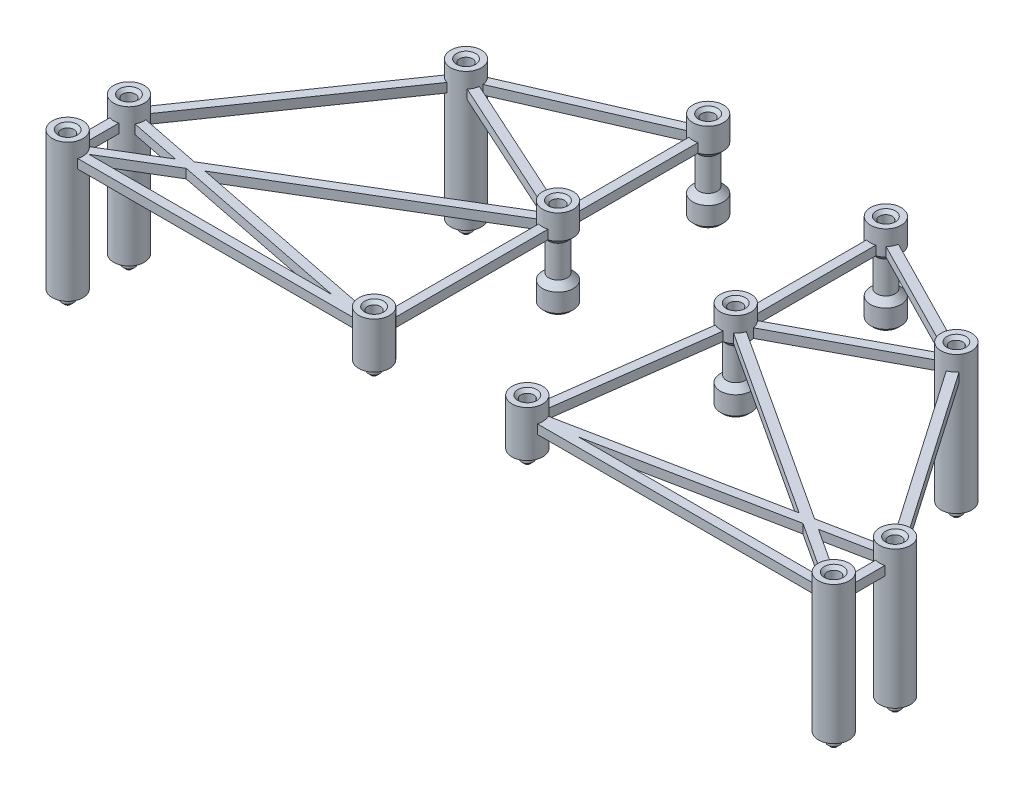
from build123d import *

# Parameters (mm, degrees)
SKETCH_2_R              = 5.000000000000076
EXTRUDE_1_DEPTH         = 40
SKETCH_2_R_2            = 5.000000000000065
EXTRUDE_1_2_DEPTH       = 40
SKETCH_2_R_3            = 5.000000000000094
EXTRUDE_1_3_DEPTH       = 40
SKETCH_2_R_4            = 5.000000000000083
EXTRUDE_1_4_DEPTH       = 40
SKETCH_2_R_5            = 5.000000000000005
EXTRUDE_1_5_DEPTH       = 40
SKETCH_2_R_6            = 5.000000000000019
EXTRUDE_1_6_DEPTH       = 40
SKETCH_2_R_7            = 4.9999999999999885
EXTRUDE_1_7_DEPTH       = 40
SKETCH_2_R_8            = 5
EXTRUDE_1_8_DEPTH       = 40
EXTRUDE_START           = -3
EXTRUDE_2_DEPTH         = 3
EXTRUDE_START_2         = -24.4
EXTRUDE_3_OUTLINE_R     = 3
EXTRUDE_3_DEPTH         = 24.4
EXTRUDE_3_2_OUTLINE_W   = 3
EXTRUDE_3_2_OUTLINE_H   = 24.400000000000002
SKETCH_5_R              = 3.0000000000017404
SKETCH_5_R_2            = 2.999999999999992
EXTRUDE_4_DEPTH         = 24.4
EXTRUDE_5_DEPTH         = 5
EXTRUDE_5_DEPTH_BACK    = 3
SKETCH_6_R              = 5.000000000000004
SKETCH_6_R_2            = 4.999999999999988
SKETCH_6_R_3            = 5.00000000000002
SKETCH_6_R_4            = 4.999999999999998
SKETCH_6_R_5            = 4.999999999999999
SKETCH_6_R_6            = 5.000000000000106
SKETCH_6_R_7            = 5.000000000000005
SKETCH_6_R_8            = 5.000000000000002
CHAMFER_1_SIZE          = 2
CHAMFER_2_SIZE          = 2
SKETCH_7_R              = 2.100000000000004
SKETCH_7_R_2            = 2.100000000000005
SKETCH_7_R_3            = 2.09999999999999
SKETCH_7_R_4            = 2.1000000000000183
SKETCH_7_R_5            = 2.1000000000001062
SKETCH_7_R_6            = 2.100000000000001
CUT_EXTRUDE_1_DEPTH     = 5
CUT_EXTRUDE_START       = -30
CUT_EXTRUDE_2_OUTLINE_R = 5
CUT_EXTRUDE_2_DEPTH     = 30
SKETCH_11_R             = 1.9000000000000012
SKETCH_11_R_2           = 1.9000000000000035
SKETCH_11_R_3           = 1.8999999999999737
SKETCH_11_R_4           = 1.9000000000000892
SKETCH_11_R_5           = 1.9000000000000732
EXTRUDE_6_DEPTH         = 4
SKETCH_12_R             = 1.9000000000000057
SKETCH_12_R_2           = 1.900000000000078
EXTRUDE_7_DEPTH         = 4
SKETCH_14_R             = 4.999999999999998
SKETCH_14_R_2           = 5.000000000000002
EXTRUDE_9_DEPTH         = 7
CHAMFER_3_SIZE          = 2
CHAMFER_4_SIZE          = 2
CUT_EXTRUDE_START_2     = -5
SKETCH_15_R             = 2.0999999999999988
SKETCH_15_R_2           = 2.100000000000002
CUT_EXTRUDE_3_DEPTH     = 5
CHAMFER_6_SIZE          = 1
CHAMFER_7_SIZE          = 1
EXTRUDE_10_DEPTH        = 5
EXTRUDE_10_DEPTH_BACK   = 3
SKETCH_17_R             = 4.999999999999998
SKETCH_17_R_2           = 5.000000000000002
CHAMFER_8_SIZE          = 2
CHAMFER_9_SIZE          = 2
SKETCH_18_R             = 2.100000000000005
CUT_EXTRUDE_4_DEPTH     = 5
CHAMFER_10_SIZE         = 1
CHAMFER_11_SIZE         = 1


# Read off the part's stored shape, not the designer's step: 보스-돌출3, 컷-돌출2
with BuildPart() as part:
    # 스케치2 → 보스-돌출1 (new body)
    with BuildSketch(Plane(origin=(0, 0, 0), x_dir=(1, 0, 0), z_dir=(0, 1, 0))):
        with Locations(Location((-25.0000000000001, 14.999999999999812, 0), (0, 0, 270))):
            Circle(SKETCH_2_R)
    extrude(amount=EXTRUDE_1_DEPTH)



with BuildPart() as body_2:
    # 스케치2 → Extrude 1 2 (new body)
    with BuildSketch(Plane(origin=(0, 0, 0), x_dir=(1, 0, 0), z_dir=(0, 1, 0))):
        with Locations(Location((-125.00000000000014, 14.999999999999108, 0), (0, 0, 270))):
            Circle(SKETCH_2_R_2)
    extrude(amount=EXTRUDE_1_2_DEPTH)


with BuildPart() as body_3:
    # 스케치2 → Extrude 1 3 (new body)
    with BuildSketch(Plane(origin=(0, 0, 0), x_dir=(1, 0, 0), z_dir=(0, 1, 0))):
        with Locations(Location((-125.00000000000028, 34.999999999999105, 0), (0, 0, 270))):
            Circle(SKETCH_2_R_3)
    extrude(amount=EXTRUDE_1_3_DEPTH)


with BuildPart() as body_4:
    # 스케치2 → Extrude 1 4 (new body)
    with BuildSketch(Plane(origin=(0, 0, 0), x_dir=(1, 0, 0), z_dir=(0, 1, 0))):
        with Locations(Location((-80.0000000000007, 99.99999999999945, 0), (0, 0, 270))):
            Circle(SKETCH_2_R_4)
    extrude(amount=EXTRUDE_1_4_DEPTH)


with BuildPart() as body_5:
    # 스케치2 → Extrude 1 5 (new body)
    with BuildSketch(Plane(origin=(0, 0, 0), x_dir=(1, 0, 0), z_dir=(0, 1, 0))):
        with Locations(Location((80.00000000000064, 99.99999999999953, 0), (0, 0, 90))):
            Circle(SKETCH_2_R_5)
    extrude(amount=EXTRUDE_1_5_DEPTH)


with BuildPart() as body_6:
    # 스케치2 → Extrude 1 6 (new body)
    with BuildSketch(Plane(origin=(0, 0, 0), x_dir=(1, 0, 0), z_dir=(0, 1, 0))):
        with Locations(Location((125.00000000000023, 34.99999999999918, 0), (0, 0, 90))):
            Circle(SKETCH_2_R_6)
    extrude(amount=EXTRUDE_1_6_DEPTH)


with BuildPart() as body_7:
    # 스케치2 → Extrude 1 7 (new body)
    with BuildSketch(Plane(origin=(0, 0, 0), x_dir=(1, 0, 0), z_dir=(0, 1, 0))):
        with Locations(Location((125.00000000000009, 14.999999999999186, 0), (0, 0, 90))):
            Circle(SKETCH_2_R_7)
    extrude(amount=EXTRUDE_1_7_DEPTH)


with BuildPart() as body_8:
    # 스케치2 → Extrude 1 8 (new body)
    with BuildSketch(Plane(origin=(0, 0, 0), x_dir=(1, 0, 0), z_dir=(0, 1, 0))):
        with Locations(Location((25.000000000000043, 14.99999999999989, 0), (0, 0, 90))):
            Circle(SKETCH_2_R_8)
    extrude(amount=EXTRUDE_1_8_DEPTH)


with BuildPart() as part_1:
    add(part.part)

    add(body_2.part)  # 보스-돌출2 merges body 2

    add(body_3.part)  # 보스-돌출2 merges body 3

    add(body_4.part)  # 보스-돌출2 merges body 4

    add(body_5.part)  # 보스-돌출2 merges body 5

    add(body_6.part)  # 보스-돌출2 merges body 6

    add(body_7.part)  # 보스-돌출2 merges body 7

    add(body_8.part)  # 보스-돌출2 merges body 8
    # 스케치3 → 보스-돌출2 (add)
    # profile 1 of 6: a face of its own
    with BuildSketch(Plane(origin=(0, 40, 0), x_dir=(1, 0, 0), z_dir=(0, 1, 0)).offset(EXTRUDE_START)):
        with BuildLine():
            ThreePointArc((120.61710246924122, 32.5937146397672), (120.09709662154395, 34.0194193243165), (120.02875406382756, 35.53545666686118))
            Line((120.02875406382756, 35.53545666686121), (101.8370079596634, 31.897107446024865))
            Line((101.8370079596634, 31.89710744602486), (35.9472519757672, 74.8686874355099))
            Line((35.9472519757672, 74.8686874355099), (76.49338655013159, 96.43578029392111))
            ThreePointArc((76.49338655013156, 96.43578029392117), (75.58563805406766, 97.6519351349886), (75.08454763100396, 99.08439746170853))
            Line((75.08454763100391, 99.08439746170858), (34.49999999999911, 77.49687212606887))
            Line((34.49999999999911, 77.49687212606887), (34.49999999999911, 121.54979470613318))
            Line((34.49999999999911, 121.54979470613318), (75.06991788925826, 100.83324089034133))
            ThreePointArc((75.0699178892582, 100.83324089034127), (75.54697367546154, 102.2738857827428), (76.43424935890415, 103.5050566850647))
            Line((76.43424935890418, 103.50505668506479), (31.499999999999112, 126.45020529386733))
            Line((31.499999999999112, 126.45020529386733), (31.499999999999105, 75.0995594628136))
            Line((31.499999999999105, 75.0995594628136), (24.143538916975636, 19.926101340133343))
            ThreePointArc((24.14353891697561, 19.926101340133343), (25.660818600455123, 19.956139503413063), (27.117222619023632, 19.52961017986028))
            Line((27.117222619023533, 19.529610179860256), (34.17254014395434, 72.4444916168454))
            Line((34.17254014395434, 72.4444916168454), (97.63409054604921, 31.056523963301217))
            Line((97.63409054604921, 31.056523963301217), (29.382897530759934, 17.406285360230186))
            ThreePointArc((29.382897530759934, 17.406285360230225), (29.975666633340374, 15.492688089833296), (29.769696007084725, 13.499999999999751))
            Line((29.76969600708469, 13.49999999999989), (120.23030399291508, 13.49999999999989))
            ThreePointArc((120.23030399291511, 13.500000000000005), (120.20728339451827, 16.424734199609315), (121.82425375159892, 18.8619471469402))
            Line((121.82425375159893, 18.861947146940246), (105.42713394374478, 29.55572093466811))
            Line((105.42713394374478, 29.55572093466811), (120.61710246924122, 32.593714639767235))
        make_face()
        Polygon((119.95409395644762, 16.49999999999648), (40.148529270387456, 16.499999999997357), (101.22421653012853, 28.71513745194491), align=None, mode=Mode.SUBTRACT)
    # profile 2 of 6: a face of its own
    with BuildSketch(Plane(origin=(0, 40, 0), x_dir=(1, 0, 0), z_dir=(0, 1, 0)).offset(EXTRUDE_START)):
        with BuildLine():
            Line((81.48167027579365, 95.22457821822661), (121.05175314931489, 38.067791845293264))
            ThreePointArc((121.05175314931476, 38.067791845293215), (122.15395010584865, 39.11096095821808), (123.51832972424626, 39.77542178178426))
            Line((123.51832972424621, 39.77542178178422), (83.94824685068603, 96.93220815470531))
            ThreePointArc((83.94824685068589, 96.93220815470525), (82.84604989416886, 95.88903904179217), (81.48167027579362, 95.22457821822657))
        make_face()
    # profile 3 of 6: a face of its own
    with BuildSketch(Plane(origin=(0, 40, 0), x_dir=(1, 0, 0), z_dir=(0, 1, 0)).offset(EXTRUDE_START)):
        with BuildLine():
            ThreePointArc((126.49999999999987, 30.230303992914322), (125.00000000000631, 29.999999999999165), (123.5000000000122, 30.23030399291067))
            Line((123.5000000000122, 30.23030399291067), (123.50000000000007, 19.76969600708394))
            ThreePointArc((123.50000000000014, 19.769696007083922), (125, 19.999999999999176), (126.49999999999987, 19.769696007083972))
            Line((126.50000000000009, 19.76969600708403), (126.50000000000009, 30.230303992914262))
        make_face()
    # profile 4 of 6: a face of its own
    with BuildSketch(Plane(origin=(0, 40, 0), x_dir=(1, 0, 0), z_dir=(0, 1, 0)).offset(EXTRUDE_START)):
        with BuildLine():
            Line((-28.22126812184375, 74.81652469534747), (-100.27447464296996, 31.584600782671057))
            Line((-100.27447464296996, 31.584600782671057), (-120.02875406382549, 35.535456666842016))
            ThreePointArc((-120.02875406382549, 35.535456666841995), (-120.09709662154559, 34.019419324308174), (-120.61710246924004, 32.59371463976922))
            Line((-120.61710246924005, 32.59371463976926), (-104.09873927816453, 29.29004200155428))
            Line((-104.09873927816453, 29.290042001554276), (-121.68176304926696, 18.740227738892653))
            ThreePointArc((-121.681763049267, 18.74022773889281), (-120.18142535894629, 16.334667909478227), (-120.23030399291538, 13.499999999998998))
            Line((-120.23030399291542, 13.499999999999144), (-29.769696007084974, 13.49999999999978))
            ThreePointArc((-29.76969600708494, 13.499999999999908), (-29.975666633340524, 15.49268808983308), (-29.382897530760328, 17.406285360229695))
            Line((-29.382897530760317, 17.406285360229653), (-95.90126072183597, 30.70995799844429))
            Line((-95.90126072183597, 30.70995799844429), (-26.500000000000526, 72.35071443154622))
            Line((-26.500000000000522, 72.35071443154622), (-26.500000000000135, 19.769696007084676))
            ThreePointArc((-26.500000000000014, 19.769696007084647), (-25.00000000000019, 19.999999999999886), (-23.50000000000035, 19.7696960070847))
            Line((-23.50000000000014, 19.769696007084754), (-23.50000000000052, 72.40192378864653))
            ThreePointArc((-23.500000000000515, 72.40192378864653), (-22.000000000000533, 74.99999999999986), (-23.500000000000554, 77.59807621135316))
            Line((-23.50000000000055, 77.59807621135316), (-23.50000000000087, 121.40192378864653))
            ThreePointArc((-23.50000000000087, 121.40192378864653), (-23.35675627251289, 126.509930288289), (-27.98115583973535, 124.33572289051686))
            Line((-27.98115583973535, 124.33572289051686), (-76.22830247067887, 103.28242254246837))
            ThreePointArc((-76.22830247067888, 103.28242254246844), (-75.4173031081525, 101.99972228007876), (-75.0284691026313, 100.53280440735954))
            Line((-75.0284691026313, 100.5328044073595), (-26.500000000000874, 121.7088636521441))
            Line((-26.500000000000874, 121.7088636521441), (-26.50000000000055, 77.32950626912636))
            Line((-26.50000000000055, 77.32950626912636), (-75.03712423101166, 99.39183546504006))
            ThreePointArc((-75.03712423101166, 99.39183546504006), (-75.4481676126876, 97.9309852784935), (-76.27853306391522, 96.66073603265225))
            Line((-76.2785330639152, 96.66073603265227), (-28.22126812184375, 74.81652469534747))
        make_face()
        Polygon((-119.58452405257749, 16.499999999999147), (-99.72552535703053, 28.41539921732751), (-40.1485292703895, 16.499999999999723), align=None, mode=Mode.SUBTRACT)
    # profile 5 of 6: a face of its own
    with BuildSketch(Plane(origin=(0, 40, 0), x_dir=(1, 0, 0), z_dir=(0, 1, 0)).offset(EXTRUDE_START)):
        with BuildLine():
            ThreePointArc((-123.5183297242462, 39.775421781784225), (-122.15395010584865, 39.11096095821805), (-121.0517531493148, 38.06779184529323))
            Line((-121.05175314931492, 38.06779184529327), (-81.48167027575474, 95.22457821821436))
            ThreePointArc((-81.48167027575471, 95.22457821821432), (-82.84604989415217, 95.8890390417804), (-83.94824685068599, 96.93220815470511))
            Line((-83.94824685068615, 96.93220815470518), (-123.5183297242462, 39.77542178178425))
        make_face()
    # profile 6 of 6: a face of its own
    with BuildSketch(Plane(origin=(0, 40, 0), x_dir=(1, 0, 0), z_dir=(0, 1, 0)).offset(EXTRUDE_START)):
        with BuildLine():
            Line((-123.5000000000002, 19.769696007083848), (-123.50000000000027, 30.230303992914262))
            ThreePointArc((-123.5000000000003, 30.230303992914273), (-125.00000000000027, 29.999999999999012), (-126.50000000000026, 30.23030399291427))
            Line((-126.50000000000028, 30.23030399291426), (-126.5000000000002, 19.76969600708391))
            ThreePointArc((-126.50000000000017, 19.769696007083898), (-125.00000000000011, 19.999999999999172), (-123.50000000000007, 19.769696007083883))
        make_face()
    extrude(amount=EXTRUDE_2_DEPTH)

    # 보스-돌출3 outline → 보스-돌출3 (add)
    with BuildSketch(Plane(origin=(0, 40, 0), x_dir=(1, 0, 0), z_dir=(0, 1, 0)).offset(EXTRUDE_START_2)):
        with Locations((-25, 124)):
            Circle(EXTRUDE_3_OUTLINE_R)
    extrude(amount=EXTRUDE_3_DEPTH)

    # 스케치5 → 보스-돌출4 (add)
    with BuildSketch(Plane(origin=(0, 40, 0), x_dir=(1, 0, 0), z_dir=(0, 1, 0)).offset(EXTRUDE_START_2)):
        with Locations(Location((32.99999999999949, 75.00000000000024, 0), (0, 0, 270))):
            Circle(SKETCH_5_R)
        with Locations(Location((-25.000000000000526, 74.99999999999983, 0), (0, 0, 270))):
            Circle(SKETCH_5_R_2)
    extrude(amount=EXTRUDE_4_DEPTH)



with BuildPart() as body_2_2:
    # Extrude 3 2 outline → Extrude 3 2 (revolve)
    with BuildSketch(Plane(origin=(33, 0, -124), x_dir=(1, 0, 0), z_dir=(0, 0, 1))):
        with Locations((1.5, 27.799999999999997)):
            Rectangle(EXTRUDE_3_2_OUTLINE_W, EXTRUDE_3_2_OUTLINE_H)
    revolve(axis=Axis((33, 0, -124), (0, 1, 0)))


with BuildPart() as part_2:
    add(part_1.part)

    add(body_2_2.part)  # 보스-돌출5 merges body 2 2
    # 스케치6 → 보스-돌출5 (add, two sides: drawn at the far end of the back side and taken through both)
    with BuildSketch(Plane(origin=(0, 40, 0), x_dir=(1, 0, 0), z_dir=(0, 1, 0)).offset(-EXTRUDE_5_DEPTH_BACK)):
        with Locations(Location((25.000000000000043, 14.99999999999989, 0), (0, 0, 90))):
            Circle(SKETCH_6_R)
        with Locations(Location((125.00000000000009, 14.999999999999186, 0), (0, 0, 90))):
            Circle(SKETCH_6_R_2)
        with Locations(Location((125.00000000000023, 34.99999999999918, 0), (0, 0, 90))):
            Circle(SKETCH_6_R_3)
        with Locations(Location((-125.00000000000011, 34.99999999999764, 0), (0, 0, 90))):
            Circle(SKETCH_6_R)
        with Locations(Location((-124.99999999999972, 14.999999999997645, 0), (0, 0, 90))):
            Circle(SKETCH_6_R_4)
        with Locations(Location((-24.999999999999677, 14.999999999999584, 0), (0, 0, 90))):
            Circle(SKETCH_6_R_5)
        with Locations(Location((-80.00000000000071, 99.99999999999945, 0), (0, 0, 270))):
            Circle(SKETCH_6_R_6)
        with Locations(Location((32.99999999999911, 124.00000000000026, 0), (0, 0, 270))):
            Circle(SKETCH_6_R_7)
        with Locations(Location((80.00000000000064, 99.99999999999953, 0), (0, 0, 90))):
            Circle(SKETCH_6_R_7)
        with Locations(Location((-25.000000000000888, 123.99999999999983, 0), (0, 0, 270))):
            Circle(SKETCH_6_R_8)
    extrude(amount=EXTRUDE_5_DEPTH + EXTRUDE_5_DEPTH_BACK)

    # 모따기1
    chamfer_1_edges = [part_2.edges().sort_by_distance(p)[0] for p in [
        (30, 37, -124),
    ]]
    chamfer(chamfer_1_edges, length=CHAMFER_1_SIZE - 0.0001)  # a hair under: the kernel refuses the full size

    # 모따기2
    chamfer_2_edges = [part_2.edges().sort_by_distance(p)[0] for p in [
        (-28.000000000000895, 37, -123.99999999999959),
    ]]
    chamfer(chamfer_2_edges, length=CHAMFER_2_SIZE - 0.0001)  # a hair under: the kernel refuses the full size

    # 스케치7 → 컷-돌출1 (cut)
    with BuildSketch(Plane(origin=(0, 45, 0), x_dir=(1, 0, 0), z_dir=(0, 1, 0))):
        with Locations(Location((25.000000000000043, 14.99999999999989, 0), (0, 0, 270))):
            Circle(SKETCH_7_R)
        with Locations(Location((32.99999999999911, 124.00000000000026, 0), (0, 0, 270))):
            Circle(SKETCH_7_R_2)
        with Locations(Location((125.00000000000009, 14.999999999999186, 0), (0, 0, 270))):
            Circle(SKETCH_7_R_3)
        with Locations(Location((125.00000000000023, 34.99999999999918, 0), (0, 0, 270))):
            Circle(SKETCH_7_R_4)
        with Locations(Location((80.00000000000064, 99.99999999999953, 0), (0, 0, 270))):
            Circle(SKETCH_7_R_2)
        with Locations(Location((-25.000000000000888, 123.99999999999983, 0), (0, 0, 270))):
            Circle(SKETCH_7_R_2)
        with Locations(Location((-80.00000000000071, 99.99999999999945, 0), (0, 0, 270))):
            Circle(SKETCH_7_R_5)
        with Locations(Location((-24.999999999999677, 14.999999999999584, 0), (0, 0, 270))):
            Circle(SKETCH_7_R_6)
        with Locations(Location((-124.99999999999972, 14.999999999997645, 0), (0, 0, 270))):
            Circle(SKETCH_7_R)
        with Locations(Location((-125.00000000000011, 34.99999999999764, 0), (0, 0, 270))):
            Circle(SKETCH_7_R_2)
    extrude(amount=-CUT_EXTRUDE_1_DEPTH, mode=Mode.SUBTRACT)

    # 컷-돌출2 outline → 컷-돌출2 (cut)
    with BuildSketch(Plane.XZ.offset(CUT_EXTRUDE_START)):
        with Locations((25, -15)):
            Circle(CUT_EXTRUDE_2_OUTLINE_R)
        with Locations((-25, -15)):
            Circle(CUT_EXTRUDE_2_OUTLINE_R)
    extrude(amount=CUT_EXTRUDE_2_DEPTH, mode=Mode.SUBTRACT)

    # 스케치11 → 보스-돌출6 (add)
    with BuildSketch(Plane.XZ):
        with Locations(Location((80.00000000000064, -99.99999999999953, 0), (0, 0, 270))):
            Circle(SKETCH_11_R)
        with Locations(Location((125.00000000000023, -34.99999999999918, 0), (0, 0, 270))):
            Circle(SKETCH_11_R_2)
        with Locations(Location((125.00000000000009, -14.999999999999186, 0), (0, 0, 270))):
            Circle(SKETCH_11_R_3)
        with Locations(Location((-80.0000000000007, -99.99999999999945, 0), (0, 0, 270))):
            Circle(SKETCH_11_R_4)
        with Locations(Location((-125.00000000000028, -34.999999999999105, 0), (0, 0, 270))):
            Circle(SKETCH_11_R_4)
        with Locations(Location((-125.00000000000014, -14.999999999999108, 0), (0, 0, 270))):
            Circle(SKETCH_11_R_5)
    extrude(amount=EXTRUDE_6_DEPTH)

    # 스케치12 → 보스-돌출7 (add)
    with BuildSketch(Plane.XZ.offset(-30)):
        with Locations(Location((25.000000000000043, -14.99999999999989, 0), (0, 0, 270))):
            Circle(SKETCH_12_R)
        with Locations(Location((-25.0000000000001, -14.999999999999812, 0), (0, 0, 270))):
            Circle(SKETCH_12_R_2)
    extrude(amount=EXTRUDE_7_DEPTH)

    # 스케치14 → 보스-돌출9 (add)
    with BuildSketch(Plane.XZ.offset(-15.600000000000003)):
        with Locations(Location((32.999999999999446, -75.00000000000024, 0), (0, 0, 270))):
            Circle(SKETCH_14_R)
        with Locations(Location((-25.00000000000056, -74.99999999999983, 0), (0, 0, 270))):
            Circle(SKETCH_14_R_2)
        with Locations(Location((-25.000000000000913, -123.99999999999983, 0), (0, 0, 90))):
            Circle(SKETCH_14_R_2)
        with Locations(Location((32.99999999999908, -124.00000000000026, 0), (0, 0, 90))):
            Circle(SKETCH_14_R)
    extrude(amount=-EXTRUDE_9_DEPTH)

    # 모따기3
    chamfer_3_edges = [part_2.edges().sort_by_distance(p)[0] for p in [
        (32.99999999999949, 22.6, -78.00000000000198),
        (30, 22.6, -124),
    ]]
    chamfer(chamfer_3_edges, length=CHAMFER_3_SIZE - 0.0001)  # a hair under: the kernel refuses the full size

    # 모따기4
    chamfer_4_edges = [part_2.edges().sort_by_distance(p)[0] for p in [
        (-25.000000000000526, 22.6, -77.99999999999982),
        (-28.000000000000888, 22.6, -123.99999999999983),
    ]]
    chamfer(chamfer_4_edges, length=CHAMFER_4_SIZE - 0.0001)  # a hair under: the kernel refuses the full size

    # 스케치15 → 컷-돌출3 (cut)
    with BuildSketch(Plane.XZ.offset(-15.600000000000003).offset(CUT_EXTRUDE_START_2)):
        with Locations(Location((32.999999999999446, -75.00000000000024, 0), (0, 0, 270))):
            Circle(SKETCH_15_R)
        with Locations(Location((-25.00000000000056, -74.99999999999983, 0), (0, 0, 270))):
            Circle(SKETCH_15_R_2)
        with Locations(Location((-25.000000000000888, -123.99999999999983, 0), (0, 0, 90))):
            Circle(SKETCH_15_R_2)
        with Locations(Location((32.99999999999908, -124.00000000000026, 0), (0, 0, 90))):
            Circle(SKETCH_15_R)
    extrude(amount=CUT_EXTRUDE_3_DEPTH, mode=Mode.SUBTRACT)

    # 모따기6
    chamfer_6_edges = [part_2.edges().sort_by_distance(p)[0] for p in [
        (25.000000000000043, 45, -17.099999999999895),
        (32.99999999999911, 45, -126.10000000000026),
        (125.00000000000009, 45, -17.099999999999177),
        (125.00000000000023, 45, -37.0999999999992),
        (80.00000000000064, 45, -102.09999999999954),
        (80.00000000000064, -4, -98.09999999999953),
        (125.00000000000023, -4, -33.09999999999918),
        (125.00000000000009, -4, -13.099999999999213),
        (25.000000000000043, 26, -13.099999999999884),
        (32.999999999999446, 15.600000000000003, -70.00000000000024),
        (32.99999999999908, 15.600000000000003, -129.00000000000026),
        (32.999999999999446, 15.600000000000003, -72.90000000000025),
        (32.99999999999908, 15.600000000000003, -126.10000000000025),
    ]]
    chamfer(chamfer_6_edges, length=CHAMFER_6_SIZE)

    # 모따기7
    chamfer_7_edges = [part_2.edges().sort_by_distance(p)[0] for p in [
        (-25.000000000000888, 45, -126.09999999999984),
        (-80.00000000000071, 45, -102.09999999999955),
        (-24.999999999999677, 45, -17.099999999999586),
        (-124.99999999999972, 45, -17.09999999999765),
        (-125.00000000000011, 45, -37.09999999999765),
        (-80.0000000000007, -4, -98.09999999999935),
        (-125.00000000000028, -4, -33.099999999999014),
        (-125.00000000000014, -4, -13.099999999999035),
        (-25.0000000000001, 26, -13.099999999999733),
        (-25.00000000000056, 15.600000000000003, -69.99999999999983),
        (-25.000000000000913, 15.600000000000003, -128.99999999999983),
        (-25.00000000000056, 15.600000000000003, -72.89999999999982),
        (-25.000000000000888, 15.600000000000003, -126.09999999999984),
    ]]
    chamfer(chamfer_7_edges, length=CHAMFER_7_SIZE)

    # 스케치17 → 보스-돌출10 (add, two sides: drawn at the far end of the back side and taken through both)
    with BuildSketch(Plane(origin=(0, 40, 0), x_dir=(1, 0, 0), z_dir=(0, 1, 0)).offset(-EXTRUDE_10_DEPTH_BACK)):
        with Locations(Location((32.999999999999446, 75.00000000000024, 0), (0, 0, 90))):
            Circle(SKETCH_17_R)
        with Locations(Location((-25.00000000000056, 74.99999999999983, 0), (0, 0, 90))):
            Circle(SKETCH_17_R_2)
    extrude(amount=EXTRUDE_10_DEPTH + EXTRUDE_10_DEPTH_BACK)

    # 모따기8
    chamfer_8_edges = [part_2.edges().sort_by_distance(p)[0] for p in [
        (-25.000000000000526, 37, -77.99999999999982),
    ]]
    chamfer(chamfer_8_edges, length=CHAMFER_8_SIZE - 0.0001)  # a hair under: the kernel refuses the full size

    # 모따기9
    chamfer_9_edges = [part_2.edges().sort_by_distance(p)[0] for p in [
        (32.99999999999959, 37, -78.00000000000175),
    ]]
    chamfer(chamfer_9_edges, length=CHAMFER_9_SIZE - 0.0001)  # a hair under: the kernel refuses the full size

    # 스케치18 → 컷-돌출4 (cut)
    with BuildSketch(Plane(origin=(0, 45, 0), x_dir=(1, 0, 0), z_dir=(0, 1, 0))):
        with Locations(Location((32.999999999999446, 75.00000000000024, 0), (0, 0, 90))):
            Circle(SKETCH_18_R)
        with Locations(Location((-25.00000000000056, 74.99999999999983, 0), (0, 0, 90))):
            Circle(SKETCH_18_R)
    extrude(amount=-CUT_EXTRUDE_4_DEPTH, mode=Mode.SUBTRACT)

    # 모따기10
    chamfer_10_edges = [part_2.edges().sort_by_distance(p)[0] for p in [
        (32.999999999999446, 45, -72.90000000000023),
    ]]
    chamfer(chamfer_10_edges, length=CHAMFER_10_SIZE)

    # 모따기11
    chamfer_11_edges = [part_2.edges().sort_by_distance(p)[0] for p in [
        (-25.00000000000056, 45, -72.89999999999982),
    ]]
    chamfer(chamfer_11_edges, length=CHAMFER_11_SIZE)


solid = part_2.part
